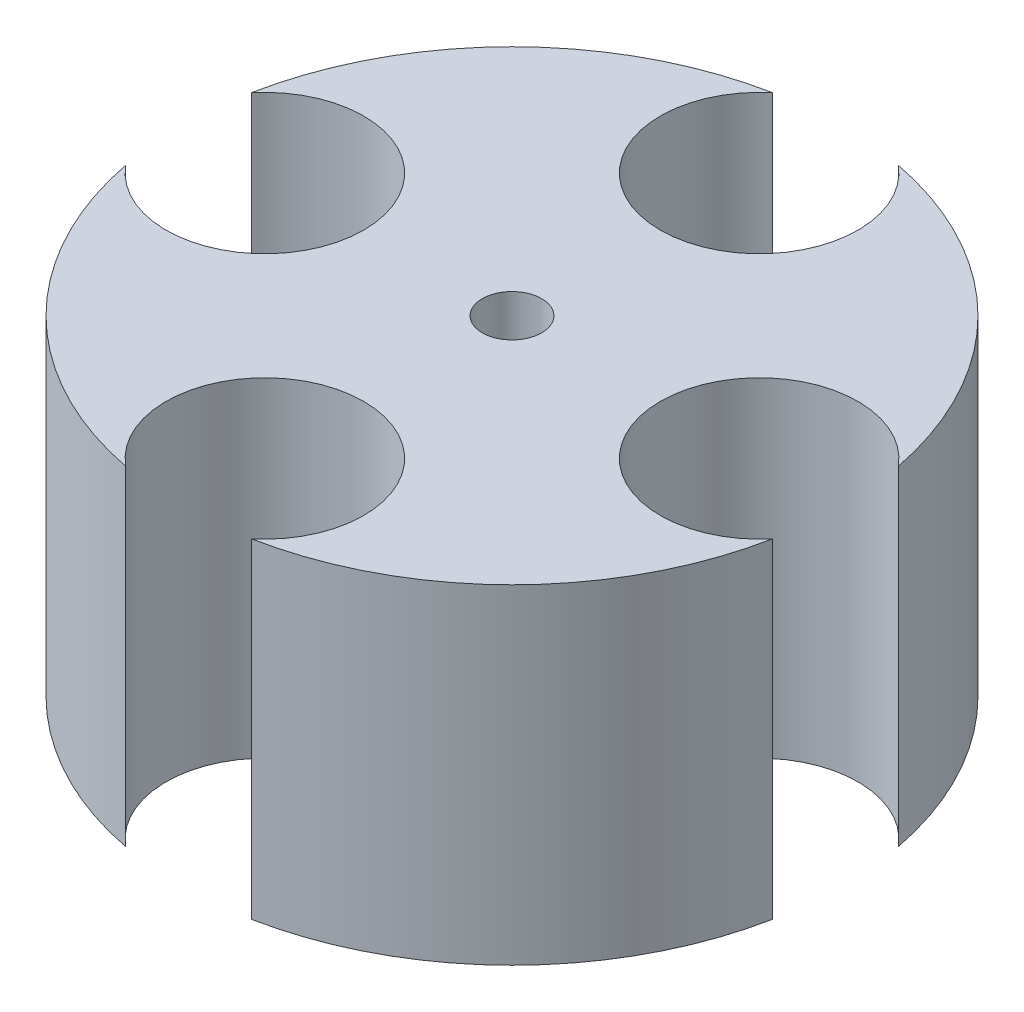
from build123d import *

# Parameters (mm, degrees)
SKETCH1_R           = 50.8
BOSS_EXTRUDE1_DEPTH = 50.8
SKETCH2_R           = 15.24
CUT_EXTRUDE1_DEPTH  = 50.8
SKETCH3_R           = 4.572242722
CUT_EXTRUDE2_DEPTH  = 87.916096497


with BuildPart() as part:
    # Sketch1 → Boss-Extrude1 (new body)
    with BuildSketch(Plane(origin=(0, 0, 0), x_dir=(1, 0, 0), z_dir=(0, 1, 0))):
        Circle(SKETCH1_R)
    extrude(amount=BOSS_EXTRUDE1_DEPTH)

    # Sketch2 → Cut-Extrude1 (cut)
    with BuildSketch(Plane(origin=(0, 50.8, 0), x_dir=(1, 0, 0), z_dir=(0, 1, 0))):
        with Locations((0, 38.1)):
            Circle(SKETCH2_R)
        with Locations((-38.1, 0)):
            Circle(SKETCH2_R)
        with Locations((0, -38.1)):
            Circle(SKETCH2_R)
        with Locations((38.1, 0)):
            Circle(SKETCH2_R)
    extrude(amount=-CUT_EXTRUDE1_DEPTH, mode=Mode.SUBTRACT)

    # Sketch3 → Cut-Extrude2 (cut, through all)
    with BuildSketch(Plane(origin=(0, 50.8, 0), x_dir=(1, 0, 0), z_dir=(0, 1, 0))):
        Circle(SKETCH3_R)
    extrude(amount=-CUT_EXTRUDE2_DEPTH, mode=Mode.SUBTRACT)


solid = part.part
